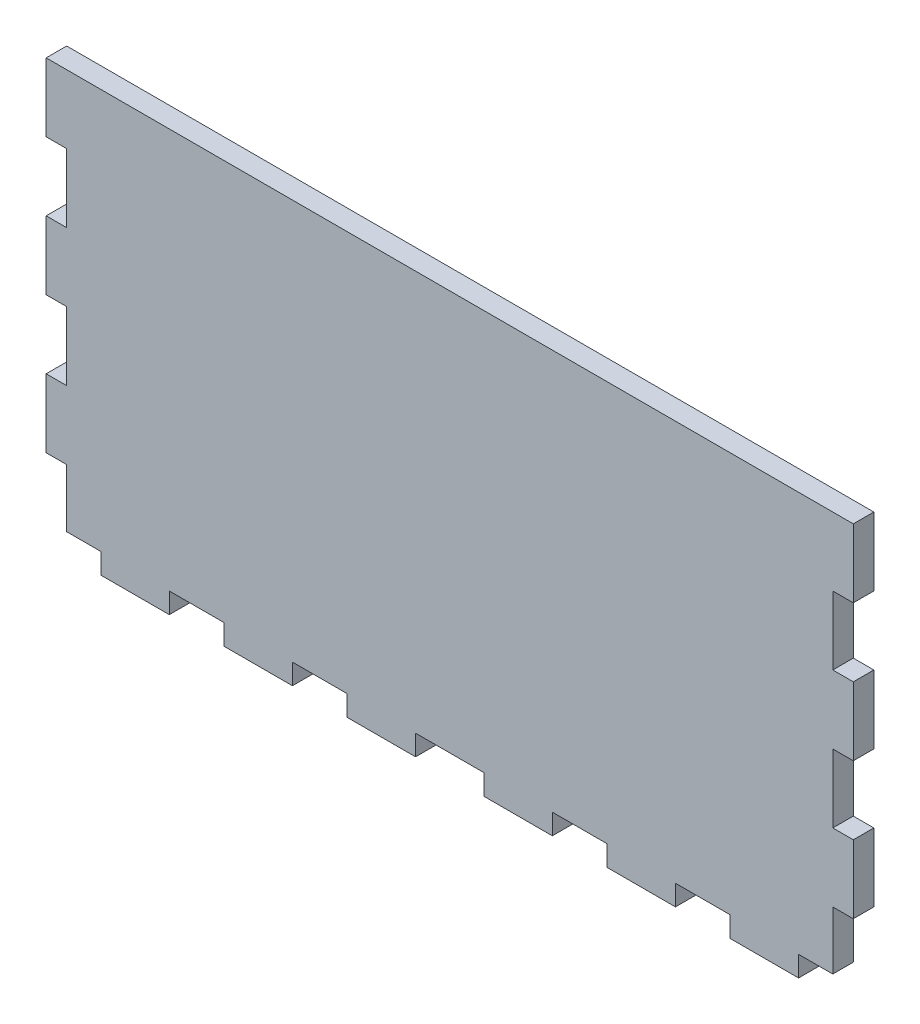
from build123d import *

# Parameters (mm, degrees)
BOSS_EXTRUDE1_DEPTH = 3


with BuildPart() as part:
    # Sketch1 → Boss-Extrude1 (new body)
    with BuildSketch(Plane.XY):
        Polygon((-56, 33), (-59, 33), (-59, 23), (-56, 23), (-56, 13), (-59, 13), (-59, 3), (-56, 3), (-56, -7), (-59, -7), (-59, -17), (-56, -17), (-56, -25.5), (-51, -25.5), (-51, -28.5), (-41, -28.5), (-41, -25.5), (-33, -25.5), (-33, -28.5), (-23, -28.5), (-23, -25.5), (-15, -25.5), (-15, -28.5), (-5, -28.5), (-5, -25.5), (5, -25.5), (5, -28.5), (15, -28.5), (15, -25.5), (23, -25.5), (23, -28.5), (33, -28.5), (33, -25.5), (41, -25.5), (41, -28.5), (51, -28.5), (51, -25.5), (56, -25.5), (56, -17), (59, -17), (59, -7), (56, -7), (56, 3), (59, 3), (59, 13), (56, 13), (56, 23), (59, 23), (59, 33), (56, 33), align=None)
    extrude(amount=BOSS_EXTRUDE1_DEPTH)


solid = part.part
